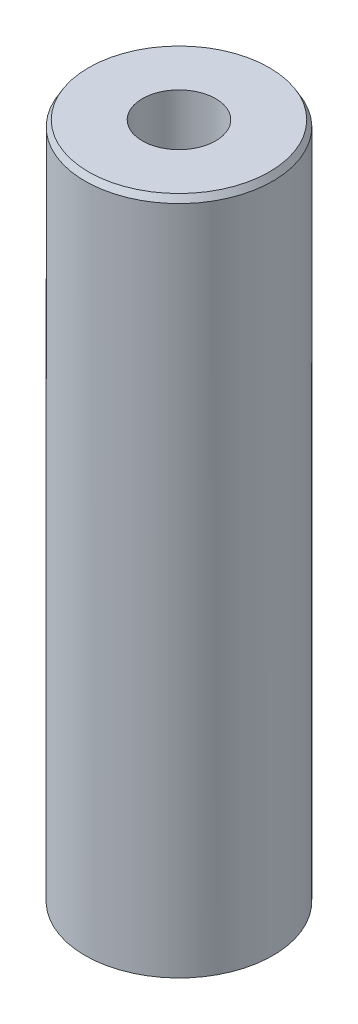
from build123d import *
from OCP.BRepFilletAPI import BRepFilletAPI_MakeChamfer

# Parameters (mm, degrees)
SKETCH1_R           = 25
BOSS_EXTRUDE1_DEPTH = 181.106623515
SKETCH2_R           = 9.753545126
CUT_EXTRUDE1_DEPTH  = 185.52536162
CHAMFER1_SIZE       = 1.648233517
CHAMFER1_SIZE2      = 0.951608065


with BuildPart() as part:
    # Sketch1 → Boss-Extrude1 (new body)
    with BuildSketch(Plane(origin=(0, 0, 0), x_dir=(1, 0, 0), z_dir=(0, 1, 0))):
        Circle(SKETCH1_R)
    extrude(amount=BOSS_EXTRUDE1_DEPTH)

    # Sketch2 → Cut-Extrude1 (cut, through all)
    with BuildSketch(Plane(origin=(0, 0, 0), x_dir=(1, 0, 0), z_dir=(0, 1, 0))):
        Circle(SKETCH2_R)
    extrude(amount=CUT_EXTRUDE1_DEPTH, mode=Mode.SUBTRACT)

    # Chamfer1: one chamfer whose edges measure the first distance from different faces: ONE call of the kernel's chamfer builder (chamfer() names one face for all edges)
    chamfer1_edges_1 = [part.edges().sort_by_distance(p)[0] for p in [
        (-25, 181.106623515, 0),
    ]]
    chamfer1_side_1 = [part.faces().sort_by_distance(p)[0] for p in [
        (-25, 90.553311758, 0),
    ]]
    chamfer1_edges_2 = [part.edges().sort_by_distance(p)[0] for p in [
        (-25, 0, 0),
    ]]
    chamfer1_side_2 = [part.faces().sort_by_distance(p)[0] for p in [
        (-24.292893219, 0, 0),
    ]]
    chamfer1 = BRepFilletAPI_MakeChamfer(part.part.solid().wrapped)
    for e in chamfer1_edges_1:
        chamfer1.Add(CHAMFER1_SIZE, CHAMFER1_SIZE2, e.wrapped, chamfer1_side_1[0].wrapped)  # the first distance lies on this face
    for e in chamfer1_edges_2:
        chamfer1.Add(CHAMFER1_SIZE, CHAMFER1_SIZE2, e.wrapped, chamfer1_side_2[0].wrapped)  # the first distance lies on this face
    add(Compound.cast(chamfer1.Shape()), mode=Mode.REPLACE)


solid = part.part
